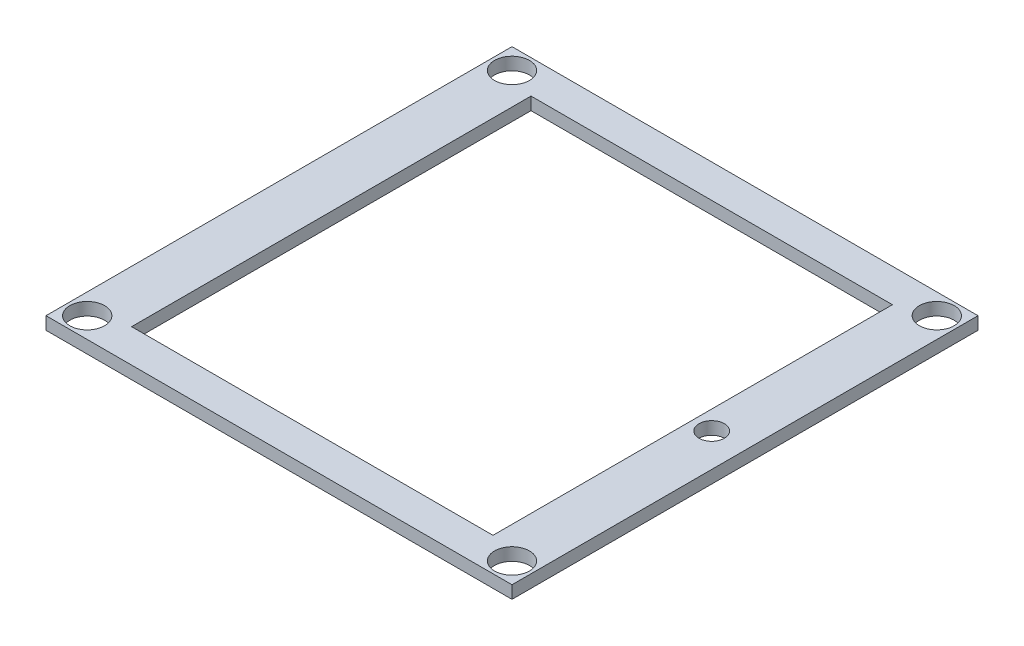
from build123d import *

# Parameters (mm, degrees)
SKETCH1_W               = 294
SKETCH1_H               = 294
SKETCH1_W_2             = 228
SKETCH1_H_2             = 252
BOSS_EXTRUDE1_DEPTH     = 8
SKETCH2_R               = 11
CUT_EXTRUDE1_DEPTH      = 209.043264731
SKETCH4_R               = 8
CUT_EXTRUDE2_DEPTH      = 209.043264731
MIRROR3_COPY_1_SKETCH_R = 11
MIRROR3_COPY_1_DEPTH    = 209.043264731


with BuildPart() as part:
    # Sketch1 → Boss-Extrude1 (new body)
    with BuildSketch(Plane(origin=(0, 0, 0), x_dir=(1, 0, 0), z_dir=(0, 1, 0))):
        Rectangle(SKETCH1_W, SKETCH1_H)
        Rectangle(SKETCH1_W_2, SKETCH1_H_2, mode=Mode.SUBTRACT)
    extrude(amount=BOSS_EXTRUDE1_DEPTH)

    # Sketch2 → Cut-Extrude1 (cut, through all)
    with BuildSketch(Plane(origin=(0, 0, 0), x_dir=(1, 0, 0), z_dir=(0, 1, 0))):
        with Locations((134, 134)):
            Circle(SKETCH2_R)
    cut_extrude1 = extrude(amount=CUT_EXTRUDE1_DEPTH, mode=Mode.SUBTRACT)

    # Mirror2: Cut-Extrude1 across plane
    add(cut_extrude1.mirror(Plane.XY), mode=Mode.SUBTRACT)

    # Sketch4 → Cut-Extrude2 (cut, through all)
    with BuildSketch(Plane(origin=(0, 8, 0), x_dir=(1, 0, 0), z_dir=(0, 1, 0))):
        with Locations((126, 0)):
            Circle(SKETCH4_R)
    extrude(amount=-CUT_EXTRUDE2_DEPTH, mode=Mode.SUBTRACT)

    # Mirror3: Cut-Extrude1 across plane
    add(cut_extrude1.mirror(Plane(origin=(0, 0, 0), x_dir=(0, 0, 1), z_dir=(1, 0, 0))), mode=Mode.SUBTRACT)

    # Mirror3 copy 1 sketch → Mirror3 copy 1 (cut, through all)
    with BuildSketch(Plane(origin=(0, 0, 0), x_dir=(-1, 0, 0), z_dir=(0, 1, 0))):
        with Locations((134, 134)):
            Circle(MIRROR3_COPY_1_SKETCH_R)
    extrude(amount=MIRROR3_COPY_1_DEPTH, mode=Mode.SUBTRACT)


solid = part.part
